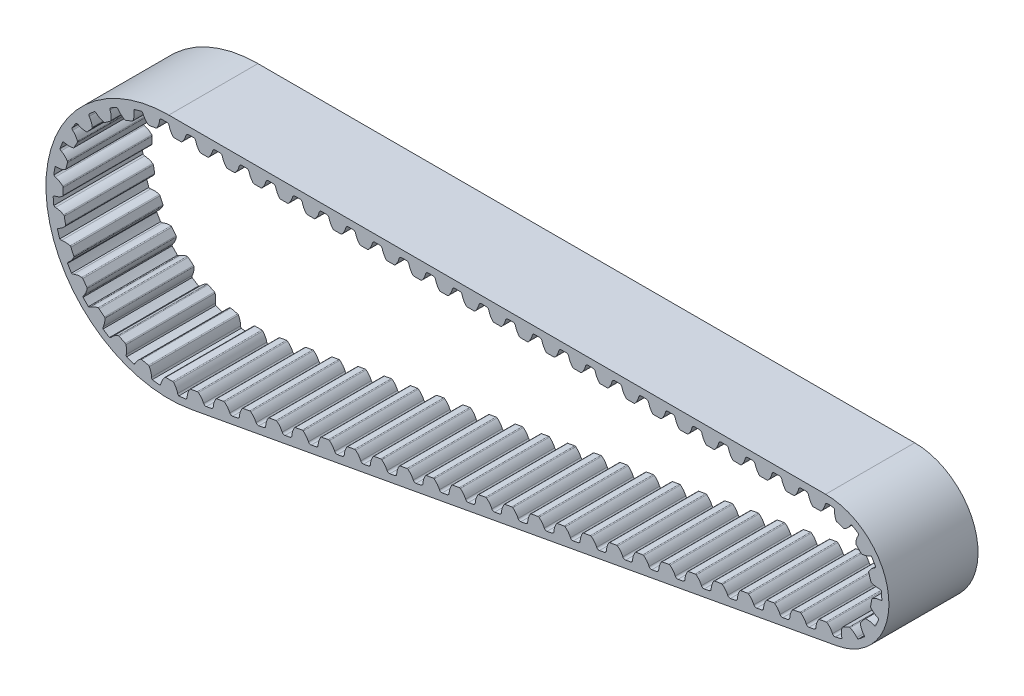
from build123d import *

# Parameters (mm, degrees)
EXTRUDE_2_DEPTH       = 10
EXTRUDE_3_DEPTH       = 10
PATTERN_CURVE_1_DEPTH = 10


# Read off the part's stored shape, not the designer's step: 曲線導出複製排列1
with BuildPart() as part:
    # 草圖2 → 填料-伸長2 (new body)
    with BuildSketch(Plane.XY):
        with BuildLine():
            Line((-36.848713597, 0.8), (36.848713597, 0.8))
            ThreePointArc((36.848713597, 0.8), (43.924662519, -5.663149662), (38.127165449, -13.294033257))
            Line((38.127165449, -13.294033257), (-34.3673834, -26.55492169))
            ThreePointArc((-34.3673834, -26.55492169), (-50.582328746, -14.235758784), (-36.848713597, 0.8))
        make_face()
        with BuildLine():
            Line((-36.848713597, 0), (36.848713597, 0))
            ThreePointArc((36.848713597, 0), (43.127933576, -5.735419932), (37.983215909, -12.507090736))
            Line((37.983215909, -12.507090736), (-34.511332941, -25.76797917))
            ThreePointArc((-34.511332941, -25.76797917), (-49.785599803, -14.163488514), (-36.848713597, 0))
        make_face(mode=Mode.SUBTRACT)
    extrude(amount=EXTRUDE_2_DEPTH)

    # 草圖3 → 填料-伸長3 (add)
    with BuildSketch(Plane.XY):
        with BuildLine():
            Line((-0.387655129, -1.11), (0.387655129, -1.11))
            ThreePointArc((0.387655129, -1.11), (0.449026444, -1.096870602), (0.49965418, -1.059780822))
            ThreePointArc((0.49965418, -1.059780822), (0.773682374, -0.664005968), (0.94382446, -0.213694013))
            ThreePointArc((0.94382446, -0.213694013), (1.042894551, -0.059811812), (1.215860333, 0))
            Line((1.215860333, 0), (-1.215860333, 0))
            ThreePointArc((-1.215860333, 0), (-1.042894551, -0.059811812), (-0.94382446, -0.213694013))
            ThreePointArc((-0.94382446, -0.213694013), (-0.773682374, -0.664005968), (-0.49965418, -1.059780822))
            ThreePointArc((-0.49965418, -1.059780822), (-0.449026444, -1.096870602), (-0.387655129, -1.11))
        make_face()
    extrude(amount=EXTRUDE_3_DEPTH)

    # 曲線導出複製排列1 outline → 曲線導出複製排列1 (add)
    with BuildSketch(Plane.XY):
        with BuildLine():
            ThreePointArc((3.932700895, -0.213694013), (4.031770985, -0.059811812), (4.204736768, 0))
            Line((4.204736768, 0), (1.773016101, 0))
            ThreePointArc((1.773016101, 0), (1.945981883, -0.059811812), (2.045051974, -0.213694013))
            ThreePointArc((2.045051974, -0.213694013), (2.215194061, -0.664005968), (2.489222254, -1.059780822))
            ThreePointArc((2.489222254, -1.059780822), (2.53984999, -1.096870602), (2.601221306, -1.11))
            Line((2.601221306, -1.11), (3.376531563, -1.11))
            ThreePointArc((3.376531563, -1.11), (3.437902879, -1.096870602), (3.488530615, -1.059780822))
            ThreePointArc((3.488530615, -1.059780822), (3.762558808, -0.664005968), (3.932700895, -0.213694013))
        make_face()
        with BuildLine():
            ThreePointArc((6.921577329, -0.213694013), (7.02064742, -0.059811812), (7.193613202, 0))
            Line((7.193613202, 0), (4.761892536, 0))
            ThreePointArc((4.761892536, 0), (4.934858318, -0.059811812), (5.033928408, -0.213694013))
            ThreePointArc((5.033928408, -0.213694013), (5.204070495, -0.664005968), (5.478098688, -1.059780822))
            ThreePointArc((5.478098688, -1.059780822), (5.528726424, -1.096870602), (5.59009774, -1.11))
            Line((5.59009774, -1.11), (6.365407998, -1.11))
            ThreePointArc((6.365407998, -1.11), (6.426779313, -1.096870602), (6.477407049, -1.059780822))
            ThreePointArc((6.477407049, -1.059780822), (6.751435242, -0.664005968), (6.921577329, -0.213694013))
        make_face()
        with BuildLine():
            ThreePointArc((9.910453764, -0.213694013), (10.009523854, -0.059811812), (10.182489637, 0))
            Line((10.182489637, 0), (7.75076897, 0))
            ThreePointArc((7.75076897, 0), (7.923734752, -0.059811812), (8.022804843, -0.213694013))
            ThreePointArc((8.022804843, -0.213694013), (8.19294693, -0.664005968), (8.466975123, -1.059780822))
            ThreePointArc((8.466975123, -1.059780822), (8.517602859, -1.096870602), (8.578974175, -1.11))
            Line((8.578974175, -1.11), (9.354284432, -1.11))
            ThreePointArc((9.354284432, -1.11), (9.415655748, -1.096870602), (9.466283484, -1.059780822))
            ThreePointArc((9.466283484, -1.059780822), (9.740311677, -0.664005968), (9.910453764, -0.213694013))
        make_face()
        with BuildLine():
            ThreePointArc((12.899330198, -0.213694013), (12.998400289, -0.059811812), (13.171366071, 0))
            Line((13.171366071, 0), (10.739645404, 0))
            ThreePointArc((10.739645404, 0), (10.912611187, -0.059811812), (11.011681277, -0.213694013))
            ThreePointArc((11.011681277, -0.213694013), (11.181823364, -0.664005968), (11.455851557, -1.059780822))
            ThreePointArc((11.455851557, -1.059780822), (11.506479293, -1.096870602), (11.567850609, -1.11))
            Line((11.567850609, -1.11), (12.343160867, -1.11))
            ThreePointArc((12.343160867, -1.11), (12.404532182, -1.096870602), (12.455159918, -1.059780822))
            ThreePointArc((12.455159918, -1.059780822), (12.729188111, -0.664005968), (12.899330198, -0.213694013))
        make_face()
        with BuildLine():
            ThreePointArc((15.888206633, -0.213694013), (15.987276723, -0.059811812), (16.160242505, 0))
            Line((16.160242505, 0), (13.728521839, 0))
            ThreePointArc((13.728521839, 0), (13.901487621, -0.059811812), (14.000557712, -0.213694013))
            ThreePointArc((14.000557712, -0.213694013), (14.170699799, -0.664005968), (14.444727992, -1.059780822))
            ThreePointArc((14.444727992, -1.059780822), (14.495355728, -1.096870602), (14.556727043, -1.11))
            Line((14.556727043, -1.11), (15.332037301, -1.11))
            ThreePointArc((15.332037301, -1.11), (15.393408617, -1.096870602), (15.444036353, -1.059780822))
            ThreePointArc((15.444036353, -1.059780822), (15.718064546, -0.664005968), (15.888206633, -0.213694013))
        make_face()
        with BuildLine():
            ThreePointArc((18.877083067, -0.213694013), (18.976153158, -0.059811812), (19.14911894, 0))
            Line((19.14911894, 0), (16.717398273, 0))
            ThreePointArc((16.717398273, 0), (16.890364056, -0.059811812), (16.989434146, -0.213694013))
            ThreePointArc((16.989434146, -0.213694013), (17.159576233, -0.664005968), (17.433604426, -1.059780822))
            ThreePointArc((17.433604426, -1.059780822), (17.484232162, -1.096870602), (17.545603478, -1.11))
            Line((17.545603478, -1.11), (18.320913735, -1.11))
            ThreePointArc((18.320913735, -1.11), (18.382285051, -1.096870602), (18.432912787, -1.059780822))
            ThreePointArc((18.432912787, -1.059780822), (18.70694098, -0.664005968), (18.877083067, -0.213694013))
        make_face()
        with BuildLine():
            ThreePointArc((21.865959501, -0.213694013), (21.965029592, -0.059811812), (22.137995374, 0))
            Line((22.137995374, 0), (19.706274708, 0))
            ThreePointArc((19.706274708, 0), (19.87924049, -0.059811812), (19.978310581, -0.213694013))
            ThreePointArc((19.978310581, -0.213694013), (20.148452668, -0.664005968), (20.422480861, -1.059780822))
            ThreePointArc((20.422480861, -1.059780822), (20.473108597, -1.096870602), (20.534479912, -1.11))
            Line((20.534479912, -1.11), (21.30979017, -1.11))
            ThreePointArc((21.30979017, -1.11), (21.371161486, -1.096870602), (21.421789222, -1.059780822))
            ThreePointArc((21.421789222, -1.059780822), (21.695817415, -0.664005968), (21.865959501, -0.213694013))
        make_face()
        with BuildLine():
            ThreePointArc((24.854835936, -0.213694013), (24.953906026, -0.059811812), (25.126871809, 0))
            Line((25.126871809, 0), (22.695151142, 0))
            ThreePointArc((22.695151142, 0), (22.868116925, -0.059811812), (22.967187015, -0.213694013))
            ThreePointArc((22.967187015, -0.213694013), (23.137329102, -0.664005968), (23.411357295, -1.059780822))
            ThreePointArc((23.411357295, -1.059780822), (23.461985031, -1.096870602), (23.523356347, -1.11))
            Line((23.523356347, -1.11), (24.298666604, -1.11))
            ThreePointArc((24.298666604, -1.11), (24.36003792, -1.096870602), (24.410665656, -1.059780822))
            ThreePointArc((24.410665656, -1.059780822), (24.684693849, -0.664005968), (24.854835936, -0.213694013))
        make_face()
        with BuildLine():
            ThreePointArc((27.84371237, -0.213694013), (27.942782461, -0.059811812), (28.115748243, 0))
            Line((28.115748243, 0), (25.684027577, 0))
            ThreePointArc((25.684027577, 0), (25.856993359, -0.059811812), (25.956063449, -0.213694013))
            ThreePointArc((25.956063449, -0.213694013), (26.126205536, -0.664005968), (26.400233729, -1.059780822))
            ThreePointArc((26.400233729, -1.059780822), (26.450861465, -1.096870602), (26.512232781, -1.11))
            Line((26.512232781, -1.11), (27.287543039, -1.11))
            ThreePointArc((27.287543039, -1.11), (27.348914354, -1.096870602), (27.39954209, -1.059780822))
            ThreePointArc((27.39954209, -1.059780822), (27.673570283, -0.664005968), (27.84371237, -0.213694013))
        make_face()
        with BuildLine():
            ThreePointArc((30.832588805, -0.213694013), (30.931658895, -0.059811812), (31.104624678, 0))
            Line((31.104624678, 0), (28.672904011, 0))
            ThreePointArc((28.672904011, 0), (28.845869793, -0.059811812), (28.944939884, -0.213694013))
            ThreePointArc((28.944939884, -0.213694013), (29.115081971, -0.664005968), (29.389110164, -1.059780822))
            ThreePointArc((29.389110164, -1.059780822), (29.4397379, -1.096870602), (29.501109216, -1.11))
            Line((29.501109216, -1.11), (30.276419473, -1.11))
            ThreePointArc((30.276419473, -1.11), (30.337790789, -1.096870602), (30.388418525, -1.059780822))
            ThreePointArc((30.388418525, -1.059780822), (30.662446718, -0.664005968), (30.832588805, -0.213694013))
        make_face()
        with BuildLine():
            ThreePointArc((33.821465239, -0.213694013), (33.92053533, -0.059811812), (34.093501112, 0))
            Line((34.093501112, 0), (31.661780445, 0))
            ThreePointArc((31.661780445, 0), (31.834746228, -0.059811812), (31.933816318, -0.213694013))
            ThreePointArc((31.933816318, -0.213694013), (32.103958405, -0.664005968), (32.377986598, -1.059780822))
            ThreePointArc((32.377986598, -1.059780822), (32.428614334, -1.096870602), (32.48998565, -1.11))
            Line((32.48998565, -1.11), (33.265295908, -1.11))
            ThreePointArc((33.265295908, -1.11), (33.326667223, -1.096870602), (33.377294959, -1.059780822))
            ThreePointArc((33.377294959, -1.059780822), (33.651323152, -0.664005968), (33.821465239, -0.213694013))
        make_face()
        with BuildLine():
            ThreePointArc((36.810341674, -0.213694013), (36.893868771, -0.072962705), (37.041791997, -0.002957019))
            ThreePointArc((37.041791997, -0.002957019), (36.945264118, -0.000739298), (36.848713597, 0))
            Line((36.848713597, 0), (34.65065688, 0))
            ThreePointArc((34.65065688, 0), (34.823622662, -0.059811812), (34.922692753, -0.213694013))
            ThreePointArc((34.922692753, -0.213694013), (35.09283484, -0.664005968), (35.366863033, -1.059780822))
            ThreePointArc((35.366863033, -1.059780822), (35.417490769, -1.096870602), (35.478862084, -1.11))
            Line((35.478862084, -1.11), (36.254172342, -1.11))
            ThreePointArc((36.254172342, -1.11), (36.315543658, -1.096870602), (36.366171394, -1.059780822))
            ThreePointArc((36.366171394, -1.059780822), (36.640199587, -0.664005968), (36.810341674, -0.213694013))
        make_face()
        with BuildLine():
            ThreePointArc((39.651242089, -0.814950156), (39.699695918, -0.756620244), (39.762024296, -0.713430831))
            ThreePointArc((39.762024296, -0.713430831), (38.821687189, -0.316644616), (37.829651032, -0.076774992))
            ThreePointArc((37.829651032, -0.076774992), (37.854100625, -0.148555), (37.858393148, -0.224263166))
            ThreePointArc((37.858393148, -0.224263166), (37.879077951, -0.70520113), (38.015497439, -1.166849166))
            ThreePointArc((38.015497439, -1.166849166), (38.051976379, -1.217918789), (38.106157076, -1.249593251))
            Line((38.106157076, -1.249593251), (38.842530328, -1.492204935))
            ThreePointArc((38.842530328, -1.492204935), (38.904927981, -1.498939349), (38.964619343, -1.479554798))
            ThreePointArc((38.964619343, -1.479554798), (39.348732196, -1.189405695), (39.651242089, -0.814950156))
        make_face()
        with BuildLine():
            ThreePointArc((41.84836483, -2.699684372), (41.918102678, -2.669905442), (41.993273575, -2.659931053))
            ThreePointArc((41.993273575, -2.659931053), (41.337759658, -1.877642948), (40.564616482, -1.211367627))
            ThreePointArc((40.564616482, -1.211367627), (40.553602943, -1.286393317), (40.522861934, -1.355712452))
            ThreePointArc((40.522861934, -1.355712452), (40.321721357, -1.793058601), (40.232358804, -2.26607395))
            ThreePointArc((40.232358804, -2.26607395), (40.241502236, -2.328164345), (40.275249143, -2.381079047))
            Line((40.275249143, -2.381079047), (40.819670291, -2.933085939))
            ThreePointArc((40.819670291, -2.933085939), (40.872112987, -2.967561772), (40.934070924, -2.977563444))
            ThreePointArc((40.934070924, -2.977563444), (41.408277459, -2.894754338), (41.84836483, -2.699684372))
        make_face()
        with BuildLine():
            ThreePointArc((42.942838791, -5.379553426), (43.018480316, -5.384893077), (43.089915155, -5.410333516))
            ThreePointArc((43.089915155, -5.410333516), (42.863794835, -4.415073361), (42.48005761, -3.469336126))
            ThreePointArc((42.48005761, -3.469336126), (42.436009924, -3.531060946), (42.377015162, -3.578703052))
            ThreePointArc((42.377015162, -3.578703052), (41.998409781, -3.87600282), (41.702973664, -4.256064245))
            ThreePointArc((41.702973664, -4.256064245), (41.682765046, -4.315481677), (41.688635449, -4.377966537))
            Line((41.688635449, -4.377966537), (41.921035054, -5.117626202))
            ThreePointArc((41.921035054, -5.117626202), (41.951956811, -5.172239976), (42.002516803, -5.209422051))
            ThreePointArc((42.002516803, -5.209422051), (42.462233073, -5.352216088), (42.942838791, -5.379553426))
        make_face()
        with BuildLine():
            ThreePointArc((42.693283057, -8.263525225), (42.758145888, -8.302805823), (42.810090063, -8.358050323))
            ThreePointArc((42.810090063, -8.358050323), (43.063233079, -7.369317908), (43.153533185, -6.352696511))
            ThreePointArc((43.153533185, -6.352696511), (43.086165853, -6.387507353), (43.011928347, -6.402965195))
            ThreePointArc((43.011928347, -6.402965195), (42.539357739, -6.494650561), (42.103005058, -6.697937362))
            ThreePointArc((42.103005058, -6.697937362), (42.057901304, -6.741577606), (42.034600513, -6.799851893))
            Line((42.034600513, -6.799851893), (41.903723972, -7.564035985))
            ThreePointArc((41.903723972, -7.564035985), (41.906305147, -7.626742898), (41.934316432, -7.682905051))
            ThreePointArc((41.934316432, -7.682905051), (42.278154248, -8.019809699), (42.693283057, -8.263525225))
        make_face()
        with BuildLine():
            ThreePointArc((41.154735935, -10.715553804), (41.19451489, -10.780112203), (41.215512365, -10.85297686))
            ThreePointArc((41.215512365, -10.85297686), (41.892089254, -10.088832314), (42.436511442, -9.225537663))
            ThreePointArc((42.436511442, -9.225537663), (42.360682002, -9.225757163), (42.287574473, -9.205621589))
            ThreePointArc((42.287574473, -9.205621589), (41.825261789, -9.071471793), (41.344228007, -9.053150054))
            ThreePointArc((41.344228007, -9.053150054), (41.28417653, -9.071388465), (41.236843421, -9.112600069))
            Line((41.236843421, -9.112600069), (40.771554919, -9.732771501))
            ThreePointArc((40.771554919, -9.732771501), (40.745226247, -9.789741848), (40.744511073, -9.852497788))
            ThreePointArc((40.744511073, -9.852497788), (40.896638675, -10.309210365), (41.154735935, -10.715553804))
        make_face()
        with BuildLine():
            ThreePointArc((38.666516514, -12.194856178), (38.672438537, -12.270454338), (38.657858421, -12.344869204))
            ThreePointArc((38.657858421, -12.344869204), (39.608653439, -11.973840892), (40.487128042, -11.454268426))
            ThreePointArc((40.487128042, -11.454268426), (40.419560309, -11.419848177), (40.363706267, -11.36855999))
            ThreePointArc((40.363706267, -11.36855999), (40.013612322, -11.038161116), (39.593987101, -10.802271608))
            ThreePointArc((39.593987101, -10.802271608), (39.532231964, -10.791085794), (39.471305624, -10.806145694))
            Line((39.471305624, -10.806145694), (38.774222278, -11.145528671))
            ThreePointArc((38.774222278, -11.145528671), (38.724790419, -11.184197919), (38.695506514, -11.239707129))
            ThreePointArc((38.695506514, -11.239707129), (38.6223729, -11.715501896), (38.666516514, -12.194856178))
        make_face()
        with BuildLine():
            ThreePointArc((35.764208986, -12.695757394), (35.694444993, -12.864954321), (35.535064686, -12.954912825))
            Line((35.535064686, -12.954912825), (37.927095173, -12.517356485))
            ThreePointArc((37.927095173, -12.517356485), (37.746190158, -12.489643844), (37.621047985, -12.356099652))
            ThreePointArc((37.621047985, -12.356099652), (37.372655183, -11.943752466), (37.031885127, -11.60374518))
            ThreePointArc((37.031885127, -11.60374518), (36.975409908, -11.576370573), (36.912677823, -11.574498436))
            Line((36.912677823, -11.574498436), (36.150022063, -11.71400538))
            ThreePointArc((36.150022063, -11.71400538), (36.092014904, -11.737963448), (36.048887327, -11.783557653))
            ThreePointArc((36.048887327, -11.783557653), (35.850546291, -12.22218052), (35.764208986, -12.695757394))
        make_face()
        with BuildLine():
            ThreePointArc((32.824116545, -13.233566629), (32.754352551, -13.402763556), (32.594972244, -13.49272206))
            Line((32.594972244, -13.49272206), (34.987002731, -13.05516572))
            ThreePointArc((34.987002731, -13.05516572), (34.806097717, -13.027453079), (34.680955543, -12.893908887))
            ThreePointArc((34.680955543, -12.893908887), (34.432562741, -12.481561701), (34.091792685, -12.141554415))
            ThreePointArc((34.091792685, -12.141554415), (34.035317466, -12.114179808), (33.972585381, -12.112307671))
            Line((33.972585381, -12.112307671), (33.209929621, -12.251814615))
            ThreePointArc((33.209929621, -12.251814615), (33.151922462, -12.275772683), (33.108794885, -12.321366888))
            ThreePointArc((33.108794885, -12.321366888), (32.910453849, -12.759989755), (32.824116545, -13.233566629))
        make_face()
        with BuildLine():
            ThreePointArc((29.884024103, -13.771375864), (29.814260109, -13.940572791), (29.654879802, -14.030531294))
            Line((29.654879802, -14.030531294), (32.046910289, -13.592974955))
            ThreePointArc((32.046910289, -13.592974955), (31.866005275, -13.565262314), (31.740863101, -13.431718122))
            ThreePointArc((31.740863101, -13.431718122), (31.492470299, -13.019370936), (31.151700243, -12.67936365))
            ThreePointArc((31.151700243, -12.67936365), (31.095225024, -12.651989043), (31.032492939, -12.650116906))
            Line((31.032492939, -12.650116906), (30.269837179, -12.78962385))
            ThreePointArc((30.269837179, -12.78962385), (30.21183002, -12.813581918), (30.168702443, -12.859176123))
            ThreePointArc((30.168702443, -12.859176123), (29.970361408, -13.29779899), (29.884024103, -13.771375864))
        make_face()
        with BuildLine():
            ThreePointArc((26.943931661, -14.309185099), (26.874167667, -14.478382026), (26.71478736, -14.568340529))
            Line((26.71478736, -14.568340529), (29.106817847, -14.13078419))
            ThreePointArc((29.106817847, -14.13078419), (28.925912833, -14.103071549), (28.800770659, -13.969527357))
            ThreePointArc((28.800770659, -13.969527357), (28.552377857, -13.557180171), (28.211607801, -13.217172885))
            ThreePointArc((28.211607801, -13.217172885), (28.155132582, -13.189798278), (28.092400497, -13.187926141))
            Line((28.092400497, -13.187926141), (27.329744737, -13.327433085))
            ThreePointArc((27.329744737, -13.327433085), (27.271737578, -13.351391153), (27.228610001, -13.396985358))
            ThreePointArc((27.228610001, -13.396985358), (27.030268966, -13.835608225), (26.943931661, -14.309185099))
        make_face()
        with BuildLine():
            ThreePointArc((24.003839219, -14.846994334), (23.934075225, -15.016191261), (23.774694918, -15.106149764))
            Line((23.774694918, -15.106149764), (26.166725405, -14.668593425))
            ThreePointArc((26.166725405, -14.668593425), (25.985820391, -14.640880784), (25.860678217, -14.507336592))
            ThreePointArc((25.860678217, -14.507336592), (25.612285416, -14.094989406), (25.271515359, -13.75498212))
            ThreePointArc((25.271515359, -13.75498212), (25.21504014, -13.727607513), (25.152308055, -13.725735376))
            Line((25.152308055, -13.725735376), (24.389652295, -13.86524232))
            ThreePointArc((24.389652295, -13.86524232), (24.331645136, -13.889200388), (24.288517559, -13.934794593))
            ThreePointArc((24.288517559, -13.934794593), (24.090176524, -14.37341746), (24.003839219, -14.846994334))
        make_face()
        with BuildLine():
            ThreePointArc((21.063746777, -15.384803569), (20.993982784, -15.554000496), (20.834602476, -15.643958999))
            Line((20.834602476, -15.643958999), (23.226632963, -15.20640266))
            ThreePointArc((23.226632963, -15.20640266), (23.045727949, -15.178690019), (22.920585775, -15.045145827))
            ThreePointArc((22.920585775, -15.045145827), (22.672192974, -14.632798641), (22.331422917, -14.292791355))
            ThreePointArc((22.331422917, -14.292791355), (22.274947698, -14.265416748), (22.212215613, -14.263544611))
            Line((22.212215613, -14.263544611), (21.449559853, -14.403051555))
            ThreePointArc((21.449559853, -14.403051555), (21.391552694, -14.427009623), (21.348425117, -14.472603828))
            ThreePointArc((21.348425117, -14.472603828), (21.150084082, -14.911226695), (21.063746777, -15.384803569))
        make_face()
        with BuildLine():
            ThreePointArc((18.123654335, -15.922612804), (18.053890342, -16.091809731), (17.894510034, -16.181768234))
            Line((17.894510034, -16.181768234), (20.286540521, -15.744211895))
            ThreePointArc((20.286540521, -15.744211895), (20.105635507, -15.716499253), (19.980493333, -15.582955062))
            ThreePointArc((19.980493333, -15.582955062), (19.732100531, -15.170607875), (19.391330475, -14.830600589))
            ThreePointArc((19.391330475, -14.830600589), (19.334855256, -14.803225983), (19.272123171, -14.801353846))
            Line((19.272123171, -14.801353846), (18.509467411, -14.94086079))
            ThreePointArc((18.509467411, -14.94086079), (18.451460253, -14.964818858), (18.408332676, -15.010413063))
            ThreePointArc((18.408332676, -15.010413063), (18.20999164, -15.44903593), (18.123654335, -15.922612804))
        make_face()
        with BuildLine():
            ThreePointArc((15.183561893, -16.460422039), (15.1137979, -16.629618966), (14.954417592, -16.719577469))
            Line((14.954417592, -16.719577469), (17.346448079, -16.28202113))
            ThreePointArc((17.346448079, -16.28202113), (17.165543065, -16.254308488), (17.040400891, -16.120764297))
            ThreePointArc((17.040400891, -16.120764297), (16.792008089, -15.70841711), (16.451238033, -15.368409824))
            ThreePointArc((16.451238033, -15.368409824), (16.394762814, -15.341035218), (16.332030729, -15.339163081))
            Line((16.332030729, -15.339163081), (15.569374969, -15.478670025))
            ThreePointArc((15.569374969, -15.478670025), (15.511367811, -15.502628093), (15.468240234, -15.548222298))
            ThreePointArc((15.468240234, -15.548222298), (15.269899198, -15.986845165), (15.183561893, -16.460422039))
        make_face()
        with BuildLine():
            ThreePointArc((12.243469451, -16.998231274), (12.173705458, -17.167428201), (12.01432515, -17.257386704))
            Line((12.01432515, -17.257386704), (14.406355637, -16.819830365))
            ThreePointArc((14.406355637, -16.819830365), (14.225450623, -16.792117723), (14.10030845, -16.658573532))
            ThreePointArc((14.10030845, -16.658573532), (13.851915648, -16.246226346), (13.511145592, -15.906219059))
            ThreePointArc((13.511145592, -15.906219059), (13.454670373, -15.878844453), (13.391938287, -15.876972316))
            Line((13.391938287, -15.876972316), (12.629282527, -16.01647926))
            ThreePointArc((12.629282527, -16.01647926), (12.571275369, -16.040437328), (12.528147792, -16.086031533))
            ThreePointArc((12.528147792, -16.086031533), (12.329806756, -16.5246544), (12.243469451, -16.998231274))
        make_face()
        with BuildLine():
            ThreePointArc((9.303377009, -17.536040509), (9.233613016, -17.705237436), (9.074232709, -17.795195939))
            Line((9.074232709, -17.795195939), (11.466263195, -17.3576396))
            ThreePointArc((11.466263195, -17.3576396), (11.285358181, -17.329926958), (11.160216008, -17.196382767))
            ThreePointArc((11.160216008, -17.196382767), (10.911823206, -16.784035581), (10.57105315, -16.444028294))
            ThreePointArc((10.57105315, -16.444028294), (10.514577931, -16.416653687), (10.451845845, -16.414781551))
            Line((10.451845845, -16.414781551), (9.689190085, -16.554288495))
            ThreePointArc((9.689190085, -16.554288495), (9.631182927, -16.578246563), (9.58805535, -16.623840768))
            ThreePointArc((9.58805535, -16.623840768), (9.389714314, -17.062463635), (9.303377009, -17.536040509))
        make_face()
        with BuildLine():
            ThreePointArc((6.363284567, -18.073849744), (6.293520574, -18.243046671), (6.134140267, -18.333005174))
            Line((6.134140267, -18.333005174), (8.526170753, -17.895448835))
            ThreePointArc((8.526170753, -17.895448835), (8.345265739, -17.867736193), (8.220123566, -17.734192002))
            ThreePointArc((8.220123566, -17.734192002), (7.971730764, -17.321844815), (7.630960708, -16.981837529))
            ThreePointArc((7.630960708, -16.981837529), (7.574485489, -16.954462922), (7.511753403, -16.952590786))
            Line((7.511753403, -16.952590786), (6.749097643, -17.09209773))
            ThreePointArc((6.749097643, -17.09209773), (6.691090485, -17.116055798), (6.647962908, -17.161650003))
            ThreePointArc((6.647962908, -17.161650003), (6.449621872, -17.60027287), (6.363284567, -18.073849744))
        make_face()
        with BuildLine():
            ThreePointArc((3.423192125, -18.611658979), (3.353428132, -18.780855906), (3.194047825, -18.870814409))
            Line((3.194047825, -18.870814409), (5.586078312, -18.43325807))
            ThreePointArc((5.586078312, -18.43325807), (5.405173298, -18.405545428), (5.280031124, -18.272001237))
            ThreePointArc((5.280031124, -18.272001237), (5.031638322, -17.85965405), (4.690868266, -17.519646764))
            ThreePointArc((4.690868266, -17.519646764), (4.634393047, -17.492272157), (4.571660961, -17.490400021))
            Line((4.571660961, -17.490400021), (3.809005201, -17.629906965))
            ThreePointArc((3.809005201, -17.629906965), (3.750998043, -17.653865033), (3.707870466, -17.699459238))
            ThreePointArc((3.707870466, -17.699459238), (3.50952943, -18.138082105), (3.423192125, -18.611658979))
        make_face()
        with BuildLine():
            ThreePointArc((0.483099683, -19.149468214), (0.41333569, -19.318665141), (0.253955383, -19.408623644))
            Line((0.253955383, -19.408623644), (2.64598587, -18.971067305))
            ThreePointArc((2.64598587, -18.971067305), (2.465080856, -18.943354663), (2.339938682, -18.809810472))
            ThreePointArc((2.339938682, -18.809810472), (2.09154588, -18.397463285), (1.750775824, -18.057455999))
            ThreePointArc((1.750775824, -18.057455999), (1.694300605, -18.030081392), (1.631568519, -18.028209256))
            Line((1.631568519, -18.028209256), (0.868912759, -18.1677162))
            ThreePointArc((0.868912759, -18.1677162), (0.810905601, -18.191674268), (0.767778024, -18.237268473))
            ThreePointArc((0.767778024, -18.237268473), (0.569436988, -18.67589134), (0.483099683, -19.149468214))
        make_face()
        with BuildLine():
            ThreePointArc((-2.456992759, -19.687277449), (-2.526756752, -19.856474376), (-2.686137059, -19.946432879))
            Line((-2.686137059, -19.946432879), (-0.294106572, -19.50887654))
            ThreePointArc((-0.294106572, -19.50887654), (-0.475011586, -19.481163898), (-0.60015376, -19.347619707))
            ThreePointArc((-0.60015376, -19.347619707), (-0.848546562, -18.93527252), (-1.189316618, -18.595265234))
            ThreePointArc((-1.189316618, -18.595265234), (-1.245791837, -18.567890627), (-1.308523923, -18.566018491))
            Line((-1.308523923, -18.566018491), (-2.071179683, -18.705525435))
            ThreePointArc((-2.071179683, -18.705525435), (-2.129186841, -18.729483503), (-2.172314418, -18.775077708))
            ThreePointArc((-2.172314418, -18.775077708), (-2.370655454, -19.213700575), (-2.456992759, -19.687277449))
        make_face()
        with BuildLine():
            ThreePointArc((-5.397085201, -20.225086684), (-5.466849194, -20.394283611), (-5.626229501, -20.484242114))
            Line((-5.626229501, -20.484242114), (-3.234199014, -20.046685775))
            ThreePointArc((-3.234199014, -20.046685775), (-3.415104028, -20.018973133), (-3.540246202, -19.885428942))
            ThreePointArc((-3.540246202, -19.885428942), (-3.788639004, -19.473081755), (-4.12940906, -19.133074469))
            ThreePointArc((-4.12940906, -19.133074469), (-4.185884279, -19.105699862), (-4.248616365, -19.103827726))
            Line((-4.248616365, -19.103827726), (-5.011272124, -19.24333467))
            ThreePointArc((-5.011272124, -19.24333467), (-5.069279283, -19.267292738), (-5.11240686, -19.312886943))
            ThreePointArc((-5.11240686, -19.312886943), (-5.310747896, -19.75150981), (-5.397085201, -20.225086684))
        make_face()
        with BuildLine():
            ThreePointArc((-8.337177643, -20.762895919), (-8.406941636, -20.932092846), (-8.566321943, -21.022051349))
            Line((-8.566321943, -21.022051349), (-6.174291456, -20.58449501))
            ThreePointArc((-6.174291456, -20.58449501), (-6.35519647, -20.556782368), (-6.480338644, -20.423238177))
            ThreePointArc((-6.480338644, -20.423238177), (-6.728731446, -20.01089099), (-7.069501502, -19.670883704))
            ThreePointArc((-7.069501502, -19.670883704), (-7.125976721, -19.643509097), (-7.188708806, -19.641636961))
            Line((-7.188708806, -19.641636961), (-7.951364566, -19.781143905))
            ThreePointArc((-7.951364566, -19.781143905), (-8.009371725, -19.805101973), (-8.052499302, -19.850696178))
            ThreePointArc((-8.052499302, -19.850696178), (-8.250840338, -20.289319045), (-8.337177643, -20.762895919))
        make_face()
        with BuildLine():
            ThreePointArc((-11.277270084, -21.300705154), (-11.347034078, -21.469902081), (-11.506414385, -21.559860584))
            Line((-11.506414385, -21.559860584), (-9.114383898, -21.122304245))
            ThreePointArc((-9.114383898, -21.122304245), (-9.295288912, -21.094591603), (-9.420431086, -20.961047412))
            ThreePointArc((-9.420431086, -20.961047412), (-9.668823888, -20.548700225), (-10.009593944, -20.208692939))
            ThreePointArc((-10.009593944, -20.208692939), (-10.066069163, -20.181318332), (-10.128801248, -20.179446196))
            Line((-10.128801248, -20.179446196), (-10.891457008, -20.31895314))
            ThreePointArc((-10.891457008, -20.31895314), (-10.949464167, -20.342911208), (-10.992591744, -20.388505413))
            ThreePointArc((-10.992591744, -20.388505413), (-11.19093278, -20.82712828), (-11.277270084, -21.300705154))
        make_face()
        with BuildLine():
            ThreePointArc((-14.217362526, -21.838514389), (-14.28712652, -22.007711315), (-14.446506827, -22.097669819))
            Line((-14.446506827, -22.097669819), (-12.05447634, -21.66011348))
            ThreePointArc((-12.05447634, -21.66011348), (-12.235381354, -21.632400838), (-12.360523528, -21.498856647))
            ThreePointArc((-12.360523528, -21.498856647), (-12.60891633, -21.08650946), (-12.949686386, -20.746502174))
            ThreePointArc((-12.949686386, -20.746502174), (-13.006161605, -20.719127567), (-13.06889369, -20.717255431))
            Line((-13.06889369, -20.717255431), (-13.83154945, -20.856762375))
            ThreePointArc((-13.83154945, -20.856762375), (-13.889556609, -20.880720443), (-13.932684186, -20.926314648))
            ThreePointArc((-13.932684186, -20.926314648), (-14.131025221, -21.364937515), (-14.217362526, -21.838514389))
        make_face()
        with BuildLine():
            ThreePointArc((-17.157454968, -22.376323624), (-17.227218962, -22.54552055), (-17.386599269, -22.635479054))
            Line((-17.386599269, -22.635479054), (-14.994568782, -22.197922715))
            ThreePointArc((-14.994568782, -22.197922715), (-15.175473796, -22.170210073), (-15.30061597, -22.036665881))
            ThreePointArc((-15.30061597, -22.036665881), (-15.549008771, -21.624318695), (-15.889778828, -21.284311409))
            ThreePointArc((-15.889778828, -21.284311409), (-15.946254047, -21.256936802), (-16.008986132, -21.255064666))
            Line((-16.008986132, -21.255064666), (-16.771641892, -21.39457161))
            ThreePointArc((-16.771641892, -21.39457161), (-16.829649051, -21.418529677), (-16.872776628, -21.464123883))
            ThreePointArc((-16.872776628, -21.464123883), (-17.071117663, -21.90274675), (-17.157454968, -22.376323624))
        make_face()
        with BuildLine():
            ThreePointArc((-20.09754741, -22.914132859), (-20.167311404, -23.083329785), (-20.326691711, -23.173288289))
            Line((-20.326691711, -23.173288289), (-17.934661224, -22.73573195))
            ThreePointArc((-17.934661224, -22.73573195), (-18.115566238, -22.708019308), (-18.240708412, -22.574475116))
            ThreePointArc((-18.240708412, -22.574475116), (-18.489101213, -22.16212793), (-18.82987127, -21.822120644))
            ThreePointArc((-18.82987127, -21.822120644), (-18.886346489, -21.794746037), (-18.949078574, -21.792873901))
            Line((-18.949078574, -21.792873901), (-19.711734334, -21.932380845))
            ThreePointArc((-19.711734334, -21.932380845), (-19.769741493, -21.956338912), (-19.81286907, -22.001933118))
            ThreePointArc((-19.81286907, -22.001933118), (-20.011210105, -22.440555985), (-20.09754741, -22.914132859))
        make_face()
        with BuildLine():
            ThreePointArc((-23.037639852, -23.451942094), (-23.107403846, -23.621139021), (-23.266784153, -23.711097524))
            Line((-23.266784153, -23.711097524), (-20.874753666, -23.273541185))
            ThreePointArc((-20.874753666, -23.273541185), (-21.05565868, -23.245828543), (-21.180800854, -23.112284351))
            ThreePointArc((-21.180800854, -23.112284351), (-21.429193655, -22.699937165), (-21.769963712, -22.359929879))
            ThreePointArc((-21.769963712, -22.359929879), (-21.826438931, -22.332555272), (-21.889171016, -22.330683136))
            Line((-21.889171016, -22.330683136), (-22.651826776, -22.47019008))
            ThreePointArc((-22.651826776, -22.47019008), (-22.709833935, -22.494148147), (-22.752961512, -22.539742353))
            ThreePointArc((-22.752961512, -22.539742353), (-22.951302547, -22.97836522), (-23.037639852, -23.451942094))
        make_face()
        with BuildLine():
            ThreePointArc((-25.977732294, -23.989751329), (-26.047496288, -24.158948256), (-26.206876595, -24.248906759))
            Line((-26.206876595, -24.248906759), (-23.814846108, -23.81135042))
            ThreePointArc((-23.814846108, -23.81135042), (-23.995751122, -23.783637778), (-24.120893296, -23.650093586))
            ThreePointArc((-24.120893296, -23.650093586), (-24.369286097, -23.2377464), (-24.710056154, -22.897739114))
            ThreePointArc((-24.710056154, -22.897739114), (-24.766531373, -22.870364507), (-24.829263458, -22.868492371))
            Line((-24.829263458, -22.868492371), (-25.591919218, -23.007999315))
            ThreePointArc((-25.591919218, -23.007999315), (-25.649926377, -23.031957382), (-25.693053953, -23.077551588))
            ThreePointArc((-25.693053953, -23.077551588), (-25.891394989, -23.516174455), (-25.977732294, -23.989751329))
        make_face()
        with BuildLine():
            ThreePointArc((-28.917824736, -24.527560564), (-28.98758873, -24.696757491), (-29.146969037, -24.786715994))
            Line((-29.146969037, -24.786715994), (-26.75493855, -24.349159655))
            ThreePointArc((-26.75493855, -24.349159655), (-26.935843564, -24.321447013), (-27.060985738, -24.187902821))
            ThreePointArc((-27.060985738, -24.187902821), (-27.309378539, -23.775555635), (-27.650148596, -23.435548349))
            ThreePointArc((-27.650148596, -23.435548349), (-27.706623815, -23.408173742), (-27.7693559, -23.406301606))
            Line((-27.7693559, -23.406301606), (-28.53201166, -23.545808549))
            ThreePointArc((-28.53201166, -23.545808549), (-28.590018818, -23.569766617), (-28.633146395, -23.615360823))
            ThreePointArc((-28.633146395, -23.615360823), (-28.831487431, -24.05398369), (-28.917824736, -24.527560564))
        make_face()
        with BuildLine():
            ThreePointArc((-31.857917178, -25.065369799), (-31.927681172, -25.234566726), (-32.087061479, -25.324525229))
            Line((-32.087061479, -25.324525229), (-29.695030992, -24.88696889))
            ThreePointArc((-29.695030992, -24.88696889), (-29.875936006, -24.859256248), (-30.001078179, -24.725712056))
            ThreePointArc((-30.001078179, -24.725712056), (-30.249470981, -24.31336487), (-30.590241037, -23.973357584))
            ThreePointArc((-30.590241037, -23.973357584), (-30.646716256, -23.945982977), (-30.709448342, -23.944110841))
            Line((-30.709448342, -23.944110841), (-31.472104102, -24.083617784))
            ThreePointArc((-31.472104102, -24.083617784), (-31.53011126, -24.107575852), (-31.573238837, -24.153170058))
            ThreePointArc((-31.573238837, -24.153170058), (-31.771579873, -24.591792925), (-31.857917178, -25.065369799))
        make_face()
        with BuildLine():
            ThreePointArc((-34.79800962, -25.603179034), (-34.847032015, -25.745863046), (-34.962976856, -25.842396545))
            ThreePointArc((-34.962976856, -25.842396545), (-34.736827089, -25.807177356), (-34.511332941, -25.76797917))
            Line((-34.511332941, -25.76797917), (-32.635123434, -25.424778125))
            ThreePointArc((-32.635123434, -25.424778125), (-32.816028448, -25.397065483), (-32.941170621, -25.263521291))
            ThreePointArc((-32.941170621, -25.263521291), (-33.189563423, -24.851174105), (-33.530333479, -24.511166819))
            ThreePointArc((-33.530333479, -24.511166819), (-33.586808698, -24.483792212), (-33.649540784, -24.481920076))
            Line((-33.649540784, -24.481920076), (-34.412196544, -24.621427019))
            ThreePointArc((-34.412196544, -24.621427019), (-34.470203702, -24.645385087), (-34.513331279, -24.690979293))
            ThreePointArc((-34.513331279, -24.690979293), (-34.711672315, -25.12960216), (-34.79800962, -25.603179034))
        make_face()
        with BuildLine():
            ThreePointArc((-37.74061363, -25.770035744), (-37.784625956, -25.866957099), (-37.861632216, -25.940447709))
            ThreePointArc((-37.861632216, -25.940447709), (-36.795928614, -25.979892753), (-35.730580774, -25.931788091))
            ThreePointArc((-35.730580774, -25.931788091), (-35.808181746, -25.858925734), (-35.852980293, -25.762365265))
            ThreePointArc((-35.852980293, -25.762365265), (-36.024950822, -25.312748403), (-36.300584988, -24.918090332))
            ThreePointArc((-36.300584988, -24.918090332), (-36.351363021, -24.881206584), (-36.412787181, -24.868326678))
            Line((-36.412787181, -24.868326678), (-37.188091037, -24.871477158))
            ThreePointArc((-37.188091037, -24.871477158), (-37.249408495, -24.88485583), (-37.299885098, -24.92215103))
            ThreePointArc((-37.299885098, -24.92215103), (-37.572302794, -25.319036133), (-37.74061363, -25.770035744))
        make_face()
        with BuildLine():
            ThreePointArc((-40.631796096, -25.229815607), (-40.696752947, -25.314144969), (-40.788490452, -25.368136303))
            ThreePointArc((-40.788490452, -25.368136303), (-39.759868737, -25.649592243), (-38.711626323, -25.845724646))
            ThreePointArc((-38.711626323, -25.845724646), (-38.770564774, -25.757084402), (-38.792160558, -25.6528517))
            ThreePointArc((-38.792160558, -25.6528517), (-38.857056746, -25.175863576), (-39.035418808, -24.728743726))
            ThreePointArc((-39.035418808, -24.728743726), (-39.076446706, -24.681251294), (-39.133314613, -24.654702083))
            Line((-39.133314613, -24.654702083), (-39.88890443, -24.480949317))
            ThreePointArc((-39.88890443, -24.480949317), (-39.951657128, -24.479990995), (-40.009309214, -24.504791326))
            ThreePointArc((-40.009309214, -24.504791326), (-40.365063424, -24.829087684), (-40.631796096, -25.229815607))
        make_face()
        with BuildLine():
            ThreePointArc((-43.323577915, -24.04445301), (-43.406055512, -24.111745505), (-43.507688915, -24.143391759))
            ThreePointArc((-43.507688915, -24.143391759), (-42.570366206, -24.65202347), (-41.594480515, -25.082055092))
            ThreePointArc((-41.594480515, -25.082055092), (-41.631649887, -24.982309056), (-41.628904627, -24.875898073))
            ThreePointArc((-41.628904627, -24.875898073), (-41.583305892, -24.396680021), (-41.654994652, -23.920665412))
            ThreePointArc((-41.654994652, -23.920665412), (-41.684109896, -23.865067552), (-41.733424127, -23.826248407))
            Line((-41.733424127, -23.826248407), (-42.42947389, -23.484750643))
            ThreePointArc((-42.42947389, -23.484750643), (-42.490354227, -23.469505839), (-42.55214304, -23.480504112))
            ThreePointArc((-42.55214304, -23.480504112), (-42.972482489, -23.715118547), (-43.323577915, -24.04445301))
        make_face()
        with BuildLine():
            ThreePointArc((-45.674079275, -22.27642665), (-45.769730346, -22.323135391), (-45.875902701, -22.330768538))
            ThreePointArc((-45.875902701, -22.330768538), (-45.079283884, -23.039766801), (-44.227192398, -23.681031315))
            ThreePointArc((-44.227192398, -23.681031315), (-44.240633549, -23.575436954), (-44.213691942, -23.472456452))
            ThreePointArc((-44.213691942, -23.472456452), (-44.060001727, -23.016267342), (-44.021238577, -22.536447997))
            ThreePointArc((-44.021238577, -22.536447997), (-44.036906544, -22.475675188), (-44.07606782, -22.426632208))
            Line((-44.07606782, -22.426632208), (-44.675889782, -21.935389285))
            ThreePointArc((-44.675889782, -21.935389285), (-44.731688846, -21.90666153), (-44.79435759, -21.903278043))
            ThreePointArc((-44.79435759, -21.903278043), (-45.257126812, -22.035844377), (-45.674079275, -22.27642665))
        make_face()
        with BuildLine():
            ThreePointArc((-47.559408747, -20.018926566), (-47.663191667, -20.042589604), (-47.768306788, -20.025807312))
            ThreePointArc((-47.768306788, -20.025807312), (-47.154380454, -20.897801884), (-46.470995646, -21.716499193))
            ThreePointArc((-46.470995646, -21.716499193), (-46.460000114, -21.610622226), (-46.410282212, -21.516500155))
            ThreePointArc((-46.410282212, -21.516500155), (-46.156601298, -21.107385037), (-46.009429386, -20.649051518))
            ThreePointArc((-46.009429386, -20.649051518), (-46.010824243, -20.586307006), (-46.037768431, -20.529625173))
            Line((-46.037768431, -20.529625173), (-46.50974687, -19.914529775))
            ThreePointArc((-46.50974687, -19.914529775), (-46.557523576, -19.873833266), (-46.617769074, -19.856246356))
            ThreePointArc((-46.617769074, -19.856246356), (-47.098576192, -19.879777216), (-47.559408747, -20.018926566))
        make_face()
        with BuildLine():
            ThreePointArc((-48.880193423, -17.390942226), (-48.986637949, -17.390312318), (-49.085155373, -17.349999157))
            ThreePointArc((-49.085155373, -17.349999157), (-48.686280665, -18.339028502), (-48.207622732, -19.292006288))
            ThreePointArc((-48.207622732, -19.292006288), (-48.172770074, -19.191427333), (-48.102896434, -19.111124728))
            ThreePointArc((-48.102896434, -19.111124728), (-47.762595966, -18.77064745), (-47.514772504, -18.357957836))
            ThreePointArc((-47.514772504, -18.357957836), (-47.501820729, -18.29654879), (-47.515127641, -18.235215719))
            Line((-47.515127641, -18.235215719), (-47.834385275, -17.528688608))
            ThreePointArc((-47.834385275, -17.528688608), (-47.871621383, -17.478168397), (-47.926268186, -17.447305046))
            ThreePointArc((-47.926268186, -17.447305046), (-48.399770572, -17.360560155), (-48.880193423, -17.390942226))
        make_face()
        with BuildLine():
            ThreePointArc((-49.566816707, -14.530990773), (-49.670312306, -14.50610112), (-49.757039328, -14.444381937))
            ThreePointArc((-49.757039328, -14.444381937), (-49.594240338, -15.49831579), (-49.345538627, -16.535344014))
            ThreePointArc((-49.345538627, -16.535344014), (-49.288665874, -16.445364439), (-49.202319433, -16.383113929))
            ThreePointArc((-49.202319433, -16.383113929), (-48.79333614, -16.129220542), (-48.457923534, -15.783927087))
            ThreePointArc((-48.457923534, -15.783927087), (-48.431307797, -15.727090285), (-48.430276045, -15.664338752))
            Line((-48.430276045, -15.664338752), (-48.57998528, -14.903619921))
            ThreePointArc((-48.57998528, -14.903619921), (-48.604718131, -14.845938854), (-48.650885885, -14.803425822))
            ThreePointArc((-48.650885885, -14.803425822), (-49.092125934, -14.610977373), (-49.566816707, -14.530990773))
        make_face()
        with BuildLine():
            ThreePointArc((-49.583087709, -11.58981599), (-49.678179282, -11.541978489), (-49.748544649, -11.46210641))
            ThreePointArc((-49.748544649, -11.46210641), (-49.830402269, -12.525393487), (-49.824765477, -13.591811934))
            ThreePointArc((-49.824765477, -13.591811934), (-49.748870309, -13.517174428), (-49.650602257, -13.476257146))
            ThreePointArc((-49.650602257, -13.476257146), (-49.194493041, -13.322329992), (-48.789170391, -13.0626326))
            ThreePointArc((-48.789170391, -13.0626326), (-48.750293566, -13.013363828), (-48.734977533, -12.952501371))
            Line((-48.734977533, -12.952501371), (-48.707247418, -12.177687177))
            ThreePointArc((-48.707247418, -12.177687177), (-48.71817338, -12.115885536), (-48.753428653, -12.063963622))
            ThreePointArc((-48.753428653, -12.063963622), (-49.139149258, -11.775955287), (-49.583087709, -11.58981599))
        make_face()
        with BuildLine():
            ThreePointArc((-48.928148808, -8.722442822), (-49.00982422, -8.654178916), (-49.060119079, -8.560363879))
            ThreePointArc((-49.060119079, -8.560363879), (-49.382318716, -9.576959901), (-49.620043949, -10.616559243))
            ThreePointArc((-49.620043949, -10.616559243), (-49.529126687, -10.561197837), (-49.424116588, -10.543770473))
            ThreePointArc((-49.424116588, -10.543770473), (-48.944922286, -10.497922822), (-48.491053544, -10.337509757))
            ThreePointArc((-48.491053544, -10.337509757), (-48.441964772, -10.298405897), (-48.413171743, -10.242640487))
            Line((-48.413171743, -10.242640487), (-48.209463891, -9.494570232))
            ThreePointArc((-48.209463891, -9.494570232), (-48.206007073, -9.43190549), (-48.228491612, -9.373311421))
            ThreePointArc((-48.228491612, -9.373311421), (-48.538362014, -9.004923691), (-48.928148808, -8.722442822))
        make_face()
        with BuildLine():
            ThreePointArc((-47.636520859, -6.08000624), (-47.700475121, -5.994914018), (-47.728048503, -5.892100874))
            ThreePointArc((-47.728048503, -5.892100874), (-48.273607495, -6.808422578), (-48.742164611, -7.766407081))
            ThreePointArc((-48.742164611, -7.766407081), (-48.641017367, -7.733239794), (-48.534800147, -7.740220916))
            ThreePointArc((-48.534800147, -7.740220916), (-48.057778377, -7.804869331), (-47.57928629, -7.752195727))
            ThreePointArc((-47.57928629, -7.752195727), (-47.522572967, -7.725317885), (-47.481820579, -7.677588833))
            Line((-47.481820579, -7.677588833), (-47.112872128, -6.995692187))
            ThreePointArc((-47.112872128, -6.995692187), (-47.095214733, -6.93546731), (-47.103743411, -6.873289491))
            ThreePointArc((-47.103743411, -6.873289491), (-47.321430804, -6.443939535), (-47.636520859, -6.08000624))
        make_face()
        with BuildLine():
            ThreePointArc((-45.776283648, -3.801785143), (-45.819145826, -3.704349689), (-45.82254438, -3.597957567))
            ThreePointArc((-45.82254438, -3.597957567), (-46.562707124, -4.365706999), (-47.237399174, -5.191582726))
            ThreePointArc((-47.237399174, -5.191582726), (-47.13135327, -5.182357755), (-47.02952748, -5.2133794))
            ThreePointArc((-47.02952748, -5.2133794), (-46.579821351, -5.385116359), (-46.101926524, -5.442958562))
            ThreePointArc((-46.101926524, -5.442958562), (-46.040577924, -5.429723429), (-45.990014175, -5.392546464))
            Line((-45.990014175, -5.392546464), (-45.475271848, -4.812765184))
            ThreePointArc((-45.475271848, -4.812765184), (-45.444344572, -4.758154534), (-45.438467855, -4.695670267))
            ThreePointArc((-45.438467855, -4.695670267), (-45.552498259, -4.227988481), (-45.776283648, -3.801785143))
        make_face()
        with BuildLine():
            ThreePointArc((-43.44548751, -2.007861173), (-43.464998401, -1.903218165), (-43.444042995, -1.798854834))
            ThreePointArc((-43.444042995, -1.798854834), (-44.339796614, -2.377565066), (-45.185061585, -3.027801336))
            ThreePointArc((-45.185061585, -3.027801336), (-45.079706542, -3.043004916), (-44.987639269, -3.096431979))
            ThreePointArc((-44.987639269, -3.096431979), (-44.58895212, -3.366205483), (-44.136843678, -3.531514717))
            ThreePointArc((-44.136843678, -3.531514717), (-44.074093395, -3.532619898), (-44.016383426, -3.50795456))
            Line((-44.016383426, -3.50795456), (-43.382978525, -3.060848055))
            ThreePointArc((-43.382978525, -3.060848055), (-43.340411498, -3.014730079), (-43.320439139, -2.955232816))
            ThreePointArc((-43.320439139, -2.955232816), (-43.324802182, -2.473870011), (-43.44548751, -2.007861173))
        make_face()
        with BuildLine():
            ThreePointArc((-40.766985238, -0.792789392), (-40.762116454, -0.686454408), (-40.717911616, -0.589620704))
            ThreePointArc((-40.717911616, -0.589620704), (-41.72204227, -0.94878878), (-42.693327504, -1.389112608))
            ThreePointArc((-42.693327504, -1.389112608), (-42.59421643, -1.427943381), (-42.516760401, -1.500959801))
            ThreePointArc((-42.516760401, -1.500959801), (-42.190106439, -1.854550489), (-41.787614346, -2.118613551))
            ThreePointArc((-41.787614346, -2.118613551), (-41.726769854, -2.134000793), (-41.66495547, -2.123147156))
            Line((-41.66495547, -2.123147156), (-40.946273824, -1.832281744))
            ThreePointArc((-40.946273824, -1.832281744), (-40.894310691, -1.797087252), (-40.861295404, -1.743713005))
            ThreePointArc((-40.861295404, -1.743713005), (-40.755761116, -1.274041098), (-40.766985238, -0.792789392))
        make_face()
        with BuildLine():
            ThreePointArc((-37.881956702, -0.220614425), (-37.852964868, -0.118192223), (-37.787840569, -0.033992107))
            ThreePointArc((-37.787840569, -0.033992107), (-38.847422027, -0.154686813), (-39.893532524, -0.361889385))
            ThreePointArc((-39.893532524, -0.361889385), (-39.805889416, -0.422300638), (-39.747127224, -0.511057828))
            ThreePointArc((-39.747127224, -0.511057828), (-39.509723893, -0.929828463), (-39.178062907, -1.278726981))
            ThreePointArc((-39.178062907, -1.278726981), (-39.122331228, -1.307585245), (-39.059670574, -1.31111539))
            Line((-39.059670574, -1.31111539), (-38.293592824, -1.191822153))
            ThreePointArc((-38.293592824, -1.191822153), (-38.234972484, -1.169406194), (-38.190654455, -1.12496824))
            ThreePointArc((-38.190654455, -1.12496824), (-37.980785391, -0.691742938), (-37.881956702, -0.220614425))
        make_face()
        with BuildLine():
            ThreePointArc((-34.922692753, -0.213694013), (-34.823622662, -0.059811812), (-34.65065688, 0))
            Line((-34.65065688, 0), (-36.848713597, 0))
            ThreePointArc((-36.848713597, 0), (-36.950610014, -0.000399655), (-37.052500161, -0.001598596))
            ThreePointArc((-37.052500161, -0.001598596), (-36.89789443, -0.069367667), (-36.810341674, -0.213694013))
            ThreePointArc((-36.810341674, -0.213694013), (-36.640199587, -0.664005968), (-36.366171394, -1.059780822))
            ThreePointArc((-36.366171394, -1.059780822), (-36.315543658, -1.096870602), (-36.254172342, -1.11))
            Line((-36.254172342, -1.11), (-35.478862084, -1.11))
            ThreePointArc((-35.478862084, -1.11), (-35.417490769, -1.096870602), (-35.366863033, -1.059780822))
            ThreePointArc((-35.366863033, -1.059780822), (-35.09283484, -0.664005968), (-34.922692753, -0.213694013))
        make_face()
        with BuildLine():
            ThreePointArc((-31.933816318, -0.213694013), (-31.834746228, -0.059811812), (-31.661780445, 0))
            Line((-31.661780445, 0), (-34.093501112, 0))
            ThreePointArc((-34.093501112, 0), (-33.92053533, -0.059811812), (-33.821465239, -0.213694013))
            ThreePointArc((-33.821465239, -0.213694013), (-33.651323152, -0.664005968), (-33.377294959, -1.059780822))
            ThreePointArc((-33.377294959, -1.059780822), (-33.326667223, -1.096870602), (-33.265295908, -1.11))
            Line((-33.265295908, -1.11), (-32.48998565, -1.11))
            ThreePointArc((-32.48998565, -1.11), (-32.428614334, -1.096870602), (-32.377986598, -1.059780822))
            ThreePointArc((-32.377986598, -1.059780822), (-32.103958405, -0.664005968), (-31.933816318, -0.213694013))
        make_face()
        with BuildLine():
            ThreePointArc((-28.944939884, -0.213694013), (-28.845869793, -0.059811812), (-28.672904011, 0))
            Line((-28.672904011, 0), (-31.104624678, 0))
            ThreePointArc((-31.104624678, 0), (-30.931658895, -0.059811812), (-30.832588805, -0.213694013))
            ThreePointArc((-30.832588805, -0.213694013), (-30.662446718, -0.664005968), (-30.388418525, -1.059780822))
            ThreePointArc((-30.388418525, -1.059780822), (-30.337790789, -1.096870602), (-30.276419473, -1.11))
            Line((-30.276419473, -1.11), (-29.501109216, -1.11))
            ThreePointArc((-29.501109216, -1.11), (-29.4397379, -1.096870602), (-29.389110164, -1.059780822))
            ThreePointArc((-29.389110164, -1.059780822), (-29.115081971, -0.664005968), (-28.944939884, -0.213694013))
        make_face()
        with BuildLine():
            ThreePointArc((-25.956063449, -0.213694013), (-25.856993359, -0.059811812), (-25.684027577, 0))
            Line((-25.684027577, 0), (-28.115748243, 0))
            ThreePointArc((-28.115748243, 0), (-27.942782461, -0.059811812), (-27.84371237, -0.213694013))
            ThreePointArc((-27.84371237, -0.213694013), (-27.673570283, -0.664005968), (-27.39954209, -1.059780822))
            ThreePointArc((-27.39954209, -1.059780822), (-27.348914354, -1.096870602), (-27.287543039, -1.11))
            Line((-27.287543039, -1.11), (-26.512232781, -1.11))
            ThreePointArc((-26.512232781, -1.11), (-26.450861465, -1.096870602), (-26.400233729, -1.059780822))
            ThreePointArc((-26.400233729, -1.059780822), (-26.126205536, -0.664005968), (-25.956063449, -0.213694013))
        make_face()
        with BuildLine():
            ThreePointArc((-22.967187015, -0.213694013), (-22.868116925, -0.059811812), (-22.695151142, 0))
            Line((-22.695151142, 0), (-25.126871809, 0))
            ThreePointArc((-25.126871809, 0), (-24.953906026, -0.059811812), (-24.854835936, -0.213694013))
            ThreePointArc((-24.854835936, -0.213694013), (-24.684693849, -0.664005968), (-24.410665656, -1.059780822))
            ThreePointArc((-24.410665656, -1.059780822), (-24.36003792, -1.096870602), (-24.298666604, -1.11))
            Line((-24.298666604, -1.11), (-23.523356347, -1.11))
            ThreePointArc((-23.523356347, -1.11), (-23.461985031, -1.096870602), (-23.411357295, -1.059780822))
            ThreePointArc((-23.411357295, -1.059780822), (-23.137329102, -0.664005968), (-22.967187015, -0.213694013))
        make_face()
        with BuildLine():
            ThreePointArc((-19.978310581, -0.213694013), (-19.87924049, -0.059811812), (-19.706274708, 0))
            Line((-19.706274708, 0), (-22.137995374, 0))
            ThreePointArc((-22.137995374, 0), (-21.965029592, -0.059811812), (-21.865959501, -0.213694013))
            ThreePointArc((-21.865959501, -0.213694013), (-21.695817415, -0.664005968), (-21.421789222, -1.059780822))
            ThreePointArc((-21.421789222, -1.059780822), (-21.371161486, -1.096870602), (-21.30979017, -1.11))
            Line((-21.30979017, -1.11), (-20.534479912, -1.11))
            ThreePointArc((-20.534479912, -1.11), (-20.473108597, -1.096870602), (-20.422480861, -1.059780822))
            ThreePointArc((-20.422480861, -1.059780822), (-20.148452668, -0.664005968), (-19.978310581, -0.213694013))
        make_face()
        with BuildLine():
            ThreePointArc((-16.989434146, -0.213694013), (-16.890364056, -0.059811812), (-16.717398273, 0))
            Line((-16.717398273, 0), (-19.14911894, 0))
            ThreePointArc((-19.14911894, 0), (-18.976153158, -0.059811812), (-18.877083067, -0.213694013))
            ThreePointArc((-18.877083067, -0.213694013), (-18.70694098, -0.664005968), (-18.432912787, -1.059780822))
            ThreePointArc((-18.432912787, -1.059780822), (-18.382285051, -1.096870602), (-18.320913735, -1.11))
            Line((-18.320913735, -1.11), (-17.545603478, -1.11))
            ThreePointArc((-17.545603478, -1.11), (-17.484232162, -1.096870602), (-17.433604426, -1.059780822))
            ThreePointArc((-17.433604426, -1.059780822), (-17.159576233, -0.664005968), (-16.989434146, -0.213694013))
        make_face()
        with BuildLine():
            ThreePointArc((-14.000557712, -0.213694013), (-13.901487621, -0.059811812), (-13.728521839, 0))
            Line((-13.728521839, 0), (-16.160242505, 0))
            ThreePointArc((-16.160242505, 0), (-15.987276723, -0.059811812), (-15.888206633, -0.213694013))
            ThreePointArc((-15.888206633, -0.213694013), (-15.718064546, -0.664005968), (-15.444036353, -1.059780822))
            ThreePointArc((-15.444036353, -1.059780822), (-15.393408617, -1.096870602), (-15.332037301, -1.11))
            Line((-15.332037301, -1.11), (-14.556727043, -1.11))
            ThreePointArc((-14.556727043, -1.11), (-14.495355728, -1.096870602), (-14.444727992, -1.059780822))
            ThreePointArc((-14.444727992, -1.059780822), (-14.170699799, -0.664005968), (-14.000557712, -0.213694013))
        make_face()
        with BuildLine():
            ThreePointArc((-11.011681277, -0.213694013), (-10.912611187, -0.059811812), (-10.739645404, 0))
            Line((-10.739645404, 0), (-13.171366071, 0))
            ThreePointArc((-13.171366071, 0), (-12.998400289, -0.059811812), (-12.899330198, -0.213694013))
            ThreePointArc((-12.899330198, -0.213694013), (-12.729188111, -0.664005968), (-12.455159918, -1.059780822))
            ThreePointArc((-12.455159918, -1.059780822), (-12.404532182, -1.096870602), (-12.343160867, -1.11))
            Line((-12.343160867, -1.11), (-11.567850609, -1.11))
            ThreePointArc((-11.567850609, -1.11), (-11.506479293, -1.096870602), (-11.455851557, -1.059780822))
            ThreePointArc((-11.455851557, -1.059780822), (-11.181823364, -0.664005968), (-11.011681277, -0.213694013))
        make_face()
        with BuildLine():
            ThreePointArc((-8.022804843, -0.213694013), (-7.923734752, -0.059811812), (-7.75076897, 0))
            Line((-7.75076897, 0), (-10.182489637, 0))
            ThreePointArc((-10.182489637, 0), (-10.009523854, -0.059811812), (-9.910453764, -0.213694013))
            ThreePointArc((-9.910453764, -0.213694013), (-9.740311677, -0.664005968), (-9.466283484, -1.059780822))
            ThreePointArc((-9.466283484, -1.059780822), (-9.415655748, -1.096870602), (-9.354284432, -1.11))
            Line((-9.354284432, -1.11), (-8.578974175, -1.11))
            ThreePointArc((-8.578974175, -1.11), (-8.517602859, -1.096870602), (-8.466975123, -1.059780822))
            ThreePointArc((-8.466975123, -1.059780822), (-8.19294693, -0.664005968), (-8.022804843, -0.213694013))
        make_face()
        with BuildLine():
            ThreePointArc((-5.033928408, -0.213694013), (-4.934858318, -0.059811812), (-4.761892536, 0))
            Line((-4.761892536, 0), (-7.193613202, 0))
            ThreePointArc((-7.193613202, 0), (-7.02064742, -0.059811812), (-6.921577329, -0.213694013))
            ThreePointArc((-6.921577329, -0.213694013), (-6.751435242, -0.664005968), (-6.477407049, -1.059780822))
            ThreePointArc((-6.477407049, -1.059780822), (-6.426779313, -1.096870602), (-6.365407998, -1.11))
            Line((-6.365407998, -1.11), (-5.59009774, -1.11))
            ThreePointArc((-5.59009774, -1.11), (-5.528726424, -1.096870602), (-5.478098688, -1.059780822))
            ThreePointArc((-5.478098688, -1.059780822), (-5.204070495, -0.664005968), (-5.033928408, -0.213694013))
        make_face()
        with BuildLine():
            Line((-3.376531563, -1.11), (-2.601221306, -1.11))
            ThreePointArc((-2.601221306, -1.11), (-2.53984999, -1.096870602), (-2.489222254, -1.059780822))
            ThreePointArc((-2.489222254, -1.059780822), (-2.215194061, -0.664005968), (-2.045051974, -0.213694013))
            ThreePointArc((-2.045051974, -0.213694013), (-1.945981883, -0.059811812), (-1.773016101, 0))
            Line((-1.773016101, 0), (-4.204736768, 0))
            ThreePointArc((-4.204736768, 0), (-4.031770985, -0.059811812), (-3.932700895, -0.213694013))
            ThreePointArc((-3.932700895, -0.213694013), (-3.762558808, -0.664005968), (-3.488530615, -1.059780822))
            ThreePointArc((-3.488530615, -1.059780822), (-3.437902879, -1.096870602), (-3.376531563, -1.11))
        make_face()
    extrude(amount=PATTERN_CURVE_1_DEPTH)


solid = part.part
